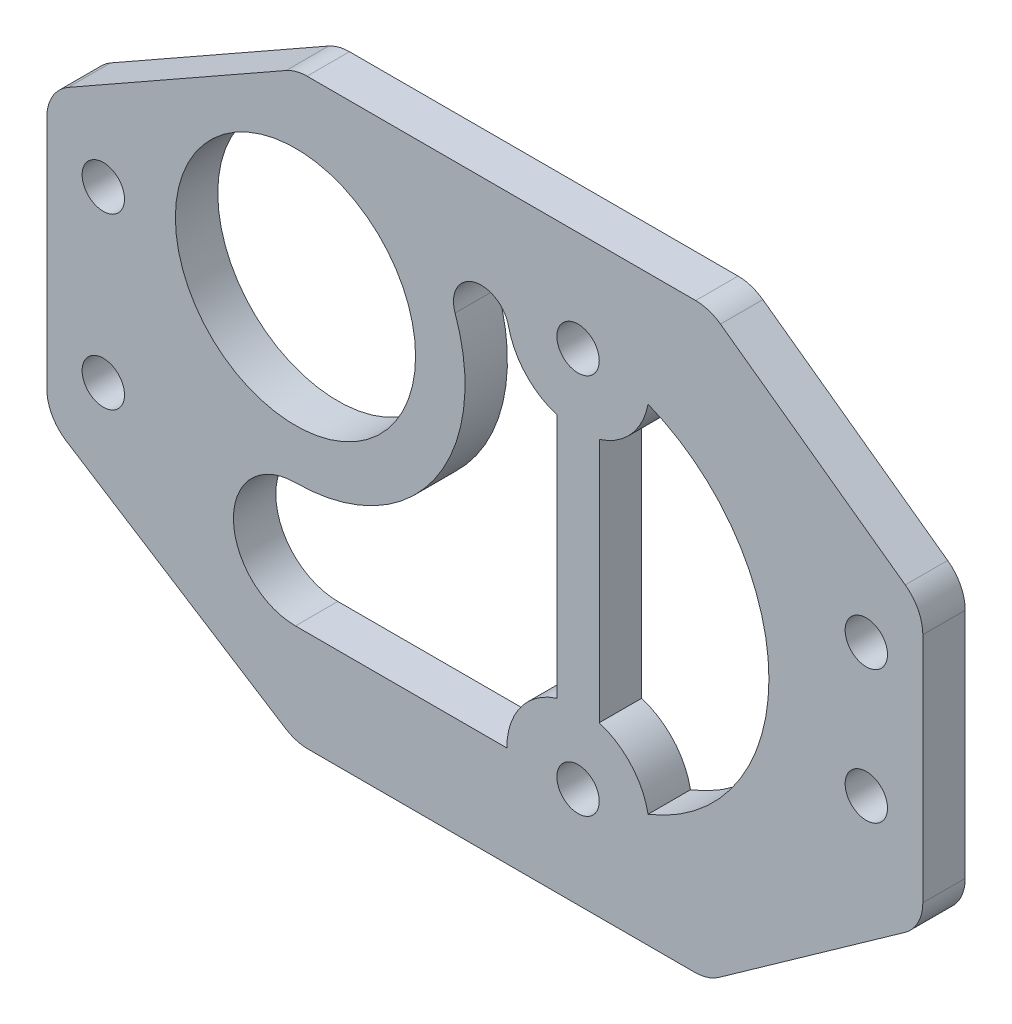
from build123d import *

# Parameters (mm, degrees)
SKETCH1_R           = 1.5
SKETCH1_R_2         = 8.5
BOSS_EXTRUDE1_DEPTH = 3


with BuildPart() as part:
    # Sketch1 → Boss-Extrude1 (new body)
    with BuildSketch(Plane.XY):
        with BuildLine():
            Line((0, 1.64796966), (0, 18.25796966))
            ThreePointArc((0, 18.25796966), (0.407702513, 19.767934474), (1.519995827, 20.867488322))
            Line((1.519995827, 20.867488322), (16.942251121, 29.614312984))
            ThreePointArc((16.942251121, 29.614312984), (17.656930521, 29.905531813), (18.422255294, 30.004794322))
            Line((18.422255294, 30.004794322), (45.922255294, 30.004794322))
            ThreePointArc((45.922255294, 30.004794322), (46.845265991, 29.859273478), (47.678731824, 29.43682849))
            Line((47.678731824, 29.43682849), (60.756476531, 19.991750808))
            ThreePointArc((60.756476531, 19.991750808), (61.671088691, 18.925471084), (62, 17.559716639))
            Line((62, 17.559716639), (62, 1.129716639))
            ThreePointArc((62, 1.129716639), (61.66533053, -0.247241299), (60.735991224, -1.316982049))
            Line((60.735991224, -1.316982049), (47.579391193, -10.651904367))
            ThreePointArc((47.579391193, -10.651904367), (46.754416966, -11.063535266), (45.84339997, -11.205205678))
            Line((45.84339997, -11.205205678), (18.50339997, -11.205205678))
            ThreePointArc((18.50339997, -11.205205678), (17.66547208, -11.085809235), (16.894241264, -10.73712358))
            Line((16.894241264, -10.73712358), (1.390841294, -0.883948242))
            ThreePointArc((1.390841294, -0.883948242), (0.370601198, 0.203579844), (0, 1.64796966))
        make_face()
        with Locations((4, 16.007488322)):
            Circle(SKETCH1_R, mode=Mode.SUBTRACT)
        with Locations((4, 4.007488322)):
            Circle(SKETCH1_R, mode=Mode.SUBTRACT)
        with Locations((58, 15.091750808)):
            Circle(SKETCH1_R, mode=Mode.SUBTRACT)
        with Locations((58, 5.678289269)):
            Circle(SKETCH1_R, mode=Mode.SUBTRACT)
        with Locations((37.6, 22.899794322)):
            Circle(SKETCH1_R, mode=Mode.SUBTRACT)
        with Locations((37.6, -4.100205678)):
            Circle(SKETCH1_R, mode=Mode.SUBTRACT)
        with Locations((17.6, 16.679794322)):
            Circle(SKETCH1_R_2, mode=Mode.SUBTRACT)
        with BuildLine():
            Line((39.1, 0.713961497), (39.1, 18.085627146))
            ThreePointArc((39.1, 18.085627146), (41.365876, 19.546529711), (42.555224583, 21.966009055))
            ThreePointArc((42.555224583, 21.966009055), (51.107923726, 9.399794322), (42.555224583, -3.166420412))
            ThreePointArc((42.555224583, -3.166420412), (41.365876, -0.746941068), (39.1, 0.713961497))
        make_face(mode=Mode.SUBTRACT)
        with BuildLine():
            Line((36.1, 18.085627146), (36.1, 0.713961497))
            ThreePointArc((36.1, 0.713961497), (33.538604534, -1.111682219), (32.55755956, -4.100205678))
            Line((32.55755956, -4.100205678), (17.6, -4.100205678))
            ThreePointArc((17.6, -4.100205678), (13.21, 0.289794322), (17.6, 4.679794322))
            ThreePointArc((17.6, 4.679794322), (27.411976087, 9.771456948), (28.897406852, 20.725606777))
            ThreePointArc((28.897406852, 20.725606777), (30.206772534, 23.282822768), (32.675850225, 21.813997568))
            ThreePointArc((32.675850225, 21.813997568), (33.886159456, 19.488988843), (36.1, 18.085627146))
        make_face(mode=Mode.SUBTRACT)
    extrude(amount=BOSS_EXTRUDE1_DEPTH)


solid = part.part
